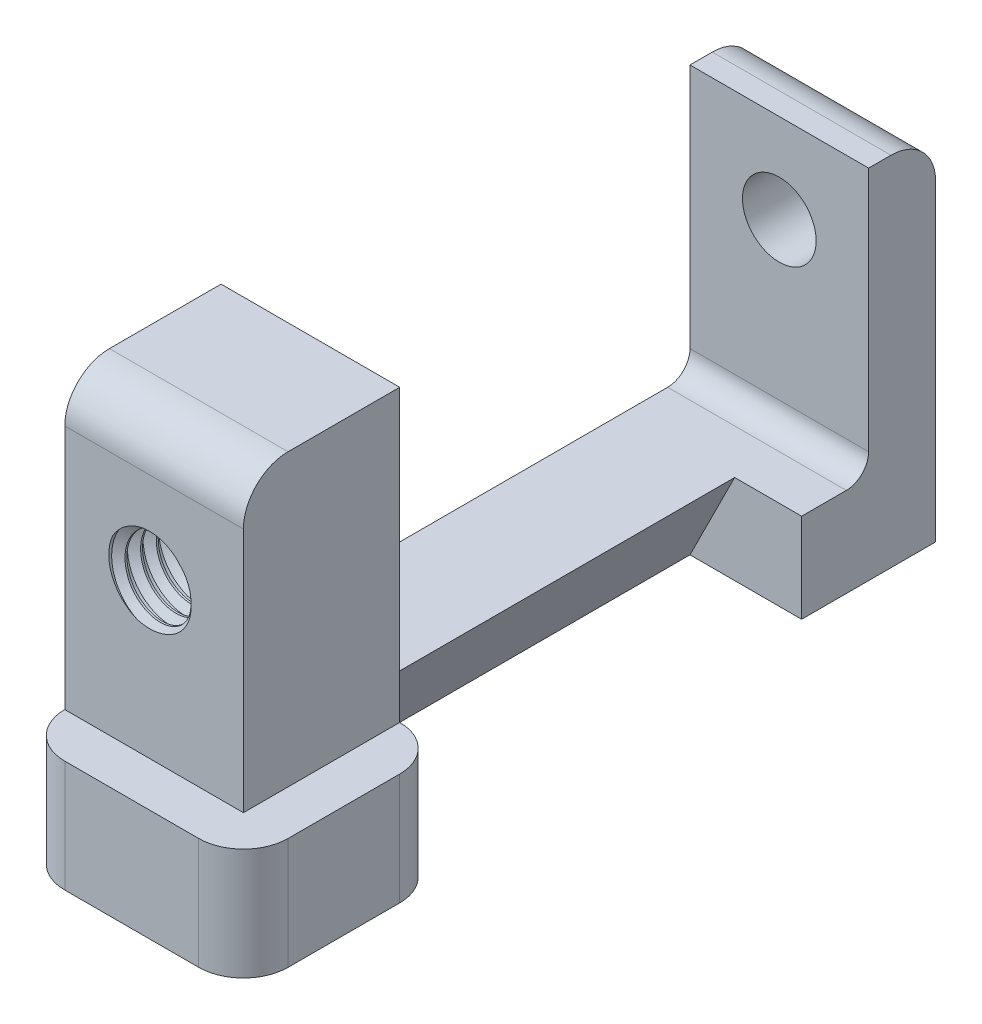
from build123d import *

# Parameters (mm, degrees)
BOSS_EXTRUDE1_DEPTH = 8
CUT_EXTRUDE2_DEPTH  = 21
SKETCH6_W           = 35.270415117
SKETCH6_H           = 22.226622545
CUT_EXTRUDE3_DEPTH  = 8
BOSS_EXTRUDE2_DEPTH = 3
BOSS_EXTRUDE7_DEPTH = 5
SKETCH7_R           = 1.65
CUT_EXTRUDE6_DEPTH  = 40.255572853
FILLET1_R           = 2
THREAD1_PITCH       = 0.7
THREAD2_PITCH       = 0.5
THREAD3_PITCH       = 0.5
FILLET2_R           = 1


# Read off the part's stored shape, not the designer's step: Tap Drill for M3x0.5 Tap, Tap Drill for M3x0.5 Tap
with BuildPart() as part:
    # Sketch1 → Boss-Extrude1 (new body)
    with BuildSketch(Plane(origin=(0, 0, 0), x_dir=(0, 0, -1), z_dir=(1, 0, 0))):
        Polygon((0, 0), (0, 16), (-3, 16), (-3, 4), (-24, 4), (-24, 18), (-31, 18), (-31, 0), align=None)
    boss_extrude1 = extrude(amount=-BOSS_EXTRUDE1_DEPTH)

    # Sketch5 → Cut-Extrude2 (cut)
    with BuildSketch(Plane.XY.offset(3)):
        Polygon((-8, 0), (-3, 0), (-5, 4), (-8, 4), align=None)
    cut_extrude2 = extrude(amount=CUT_EXTRUDE2_DEPTH, mode=Mode.SUBTRACT)

    # Mirror1: Boss-Extrude1, Cut-Extrude2 across plane
    add(boss_extrude1.mirror(Plane(origin=(-8, 0, 0), x_dir=(0, 0, 1), z_dir=(1, 0, 0))))
    add(cut_extrude2.mirror(Plane(origin=(-8, 0, 0), x_dir=(0, 0, 1), z_dir=(1, 0, 0))), mode=Mode.SUBTRACT)

    # Sketch6 → Cut-Extrude3 (cut)
    with BuildSketch(Plane(origin=(0, 0, 0), x_dir=(0, 0, -1), z_dir=(1, 0, 0))):
        with Locations((-16.260875851, 8.713036563)):
            Rectangle(SKETCH6_W, SKETCH6_H)
    extrude(amount=-CUT_EXTRUDE3_DEPTH, mode=Mode.SUBTRACT)

    # Sketch9 → Boss-Extrude2 (add)
    with BuildSketch(Plane.XY.offset(3)):
        Polygon((-11, 4), (-13, 0), (-8, 0), (-8, 4), align=None)
    extrude(amount=BOSS_EXTRUDE2_DEPTH)

    # Sketch13 → Boss-Extrude7 (add)
    with BuildSketch(Plane.XZ):
        with BuildLine():
            Line((-14, 33), (-6, 33))
            Line((-6, 33), (-6, 26))
            ThreePointArc((-6, 26), (-6.585786438, 24.585786438), (-8, 24))
            Line((-8, 24), (-8, 31))
            Line((-8, 31), (-16, 31))
            ThreePointArc((-16, 31), (-15.414213562, 32.414213562), (-14, 33))
        make_face()
    extrude(amount=-BOSS_EXTRUDE7_DEPTH)

    # Sketch7 → Cut-Extrude6 (cut, through all)
    with BuildSketch(Plane.XY.offset(31)):
        with Locations((-12, 12)):
            Circle(SKETCH7_R)
    extrude(amount=-CUT_EXTRUDE6_DEPTH, mode=Mode.SUBTRACT)

    # Fillet1
    fillet1_edges = [part.edges().sort_by_distance(p)[0] for p in [
        (-6, 2.5, 33),
        (-12, 18, 31),
        (-12, 16, 0),
    ]]
    fillet(fillet1_edges, radius=FILLET1_R)

    # Tap Drill for M3x0.5 Tap outline → Tap Drill for M3x0.5 Tap (revolve, cut)
    with BuildSketch(Plane(origin=(-11.9, 0, 3), x_dir=(1, 0, 0), z_dir=(0, 0, 1))):
        Polygon((1.25, 3), (0, 3.751075774), (0, 0), (1.25, 0), align=None)
    revolve(axis=Axis((-11.9, 0, 3), (0, 1, 0)), mode=Mode.SUBTRACT)

    # Tap Drill for M3x0.5 Tap 2 outline → Tap Drill for M3x0.5 Tap 2 (revolve, cut)
    with BuildSketch(Plane(origin=(-10.185, 0, 29), x_dir=(1, 0, 0), z_dir=(0, 0, 1))):
        Polygon((1.25, 3), (0, 3.751075774), (0, 0), (1.25, 0), align=None)
    revolve(axis=Axis((-10.185, 0, 29), (0, 1, 0)), mode=Mode.SUBTRACT)

    # Thread1: the profile of Thread Profile2 profile screwed along a right-hand helix of 10 turns, 6 arcs to a turn; built about Z, then put on its axis
    thread1_z = Axis((0, 0, 0), (0, 0, 1))
    thread1_corners = [(1.6497, 0, 0.612673207), (1.6497, 0, -0.000173205), (2.028886116, 0, 0.218750001), (2.028886116, 0, 0.393750001)]
    with BuildLine(mode=Mode.PRIVATE) as thread1_profile:
        Line(thread1_corners[0], thread1_corners[1])
        Line(thread1_corners[1], thread1_corners[2])
        Line(thread1_corners[2], thread1_corners[3])
        Line(thread1_corners[3], thread1_corners[0])
    thread1_cap = Face(thread1_profile.wire())
    thread1_turn_angles = [0, 30, 60, 90, 120, 150, 180, 210, 240, 270, 300, 330, 360]
    thread1_turn_weights = [1, 0.8660254037844387, 1, 0.8660254037844387, 1, 0.8660254037844387, 1, 0.8660254037844387, 1, 0.8660254037844387, 1, 0.8660254037844387, 1]
    thread1_turn_rails = [Edge.make_bspline([Vector(p[0], p[1], 0).rotate(thread1_z, thread1_turn_angles[k]) / thread1_turn_weights[k] + Vector(0, 0, p[2] + THREAD1_PITCH * thread1_turn_angles[k] / 360) for k in range(13)], [0, 0, 0, 1, 1, 2, 2, 3, 3, 4, 4, 5, 5, 6, 6, 6], 2, thread1_turn_weights) for p in thread1_corners]
    thread1_turn_sides = [Face.make_surface_from_curves(thread1_turn_rails[p[0]], thread1_turn_rails[p[1]]) for p in [(0, 1), (1, 2), (2, 3), (3, 0)]]
    thread1 = Plane(origin=(-12, 12, 24), x_dir=(1, 0, 0), z_dir=(0, 0, 1)) * Solid(Shell([*[p.moved(Location((0, 0, THREAD1_PITCH * i))) for i in range(10) for p in thread1_turn_sides], thread1_cap, thread1_cap.rotate(thread1_z, 3600).moved(Location((0, 0, THREAD1_PITCH * 3600 / 360)))]))
    add(thread1, mode=Mode.SUBTRACT)

    # Thread2: the profile of Thread Profile3 profile screwed along a right-hand helix of 6 turns, 6 arcs to a turn; built about Z, then put on its axis
    thread2_z = Axis((0, 0, 0), (0, 0, 1))
    thread2_corners = [(1.2497, 0, -0.000173205), (1.520632937, 0, 0.156249999), (1.520632937, 0, 0.218749999), (1.2497, 0, 0.375173204)]
    with BuildLine(mode=Mode.PRIVATE) as thread2_profile:
        Line(thread2_corners[0], thread2_corners[1])
        Line(thread2_corners[1], thread2_corners[2])
        Line(thread2_corners[2], thread2_corners[3])
        Line(thread2_corners[3], thread2_corners[0])
    thread2_cap = Face(thread2_profile.wire())
    thread2_turn_angles = [0, 30, 60, 90, 120, 150, 180, 210, 240, 270, 300, 330, 360]
    thread2_turn_weights = [1, 0.8660254037844387, 1, 0.8660254037844387, 1, 0.8660254037844387, 1, 0.8660254037844387, 1, 0.8660254037844387, 1, 0.8660254037844387, 1]
    thread2_turn_rails = [Edge.make_bspline([Vector(p[0], p[1], 0).rotate(thread2_z, thread2_turn_angles[k]) / thread2_turn_weights[k] + Vector(0, 0, p[2] + THREAD2_PITCH * thread2_turn_angles[k] / 360) for k in range(13)], [0, 0, 0, 1, 1, 2, 2, 3, 3, 4, 4, 5, 5, 6, 6, 6], 2, thread2_turn_weights) for p in thread2_corners]
    thread2_turn_sides = [Face.make_surface_from_curves(thread2_turn_rails[p[0]], thread2_turn_rails[p[1]]) for p in [(0, 1), (1, 2), (2, 3), (3, 0)]]
    thread2 = Plane(origin=(-11.9, 0, 3), x_dir=(1, 0, 0), z_dir=(0, 1, 0)) * Solid(Shell([*[p.moved(Location((0, 0, THREAD2_PITCH * i))) for i in range(6) for p in thread2_turn_sides], thread2_cap, thread2_cap.rotate(thread2_z, 2160).moved(Location((0, 0, THREAD2_PITCH * 2160 / 360)))]))
    add(thread2, mode=Mode.SUBTRACT)

    # Thread3: the profile of Thread Profile4 profile screwed along a right-hand helix of 6 turns, 6 arcs to a turn; built about Z, then put on its axis
    thread3_z = Axis((0, 0, 0), (0, 0, 1))
    thread3_corners = [(1.2497, 0, -0.000173205), (1.520632938, 0, 0.156249999), (1.520632938, 0, 0.218749999), (1.2497, 0, 0.375173204)]
    with BuildLine(mode=Mode.PRIVATE) as thread3_profile:
        Line(thread3_corners[0], thread3_corners[1])
        Line(thread3_corners[1], thread3_corners[2])
        Line(thread3_corners[2], thread3_corners[3])
        Line(thread3_corners[3], thread3_corners[0])
    thread3_cap = Face(thread3_profile.wire())
    thread3_turn_angles = [0, 30, 60, 90, 120, 150, 180, 210, 240, 270, 300, 330, 360]
    thread3_turn_weights = [1, 0.8660254037844387, 1, 0.8660254037844387, 1, 0.8660254037844387, 1, 0.8660254037844387, 1, 0.8660254037844387, 1, 0.8660254037844387, 1]
    thread3_turn_rails = [Edge.make_bspline([Vector(p[0], p[1], 0).rotate(thread3_z, thread3_turn_angles[k]) / thread3_turn_weights[k] + Vector(0, 0, p[2] + THREAD3_PITCH * thread3_turn_angles[k] / 360) for k in range(13)], [0, 0, 0, 1, 1, 2, 2, 3, 3, 4, 4, 5, 5, 6, 6, 6], 2, thread3_turn_weights) for p in thread3_corners]
    thread3_turn_sides = [Face.make_surface_from_curves(thread3_turn_rails[p[0]], thread3_turn_rails[p[1]]) for p in [(0, 1), (1, 2), (2, 3), (3, 0)]]
    thread3 = Plane(origin=(-10.185, 0, 29), x_dir=(1, 0, 0), z_dir=(0, 1, 0)) * Solid(Shell([*[p.moved(Location((0, 0, THREAD3_PITCH * i))) for i in range(6) for p in thread3_turn_sides], thread3_cap, thread3_cap.rotate(thread3_z, 2160).moved(Location((0, 0, THREAD3_PITCH * 2160 / 360)))]))
    add(thread3, mode=Mode.SUBTRACT)

    # Fillet2
    fillet2_edges = [part.edges().sort_by_distance(p)[0] for p in [
        (-13.5, 4, 24),
        (-12, 4, 3),
    ]]
    fillet(fillet2_edges, radius=FILLET2_R)


solid = part.part
